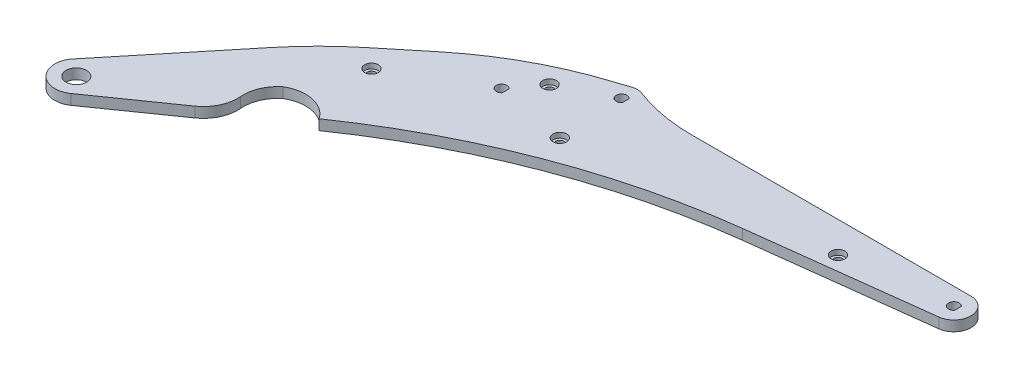
from build123d import *

# Parameters (mm, degrees)
SKETCH_3_R          = 3
EXTRUDE_1_DEPTH     = 3
FILLET_1_R          = 200
FILLET_3_R          = 50
SKETCH_4_R          = 1.25
CUT_EXTRUDE_1_DEPTH = 133.803621182
SKETCH_4_3_R        = 2
SKETCH_4_3_R_2      = 1.25
CUT_EXTRUDE_2_DEPTH = 1.5
FILLET_4_R          = 10
FILLET_5_R          = 10
FILLET_6_R          = 100


# Some blends are built 0.0001 mm under size
with BuildPart() as part:
    # 草图3 → 凸台-拉伸1 (new body)
    with BuildSketch(Plane(origin=(0, 0, 0), x_dir=(1, 0, 0), z_dir=(0, 1, 0))):
        with BuildLine():
            ThreePointArc((3.438749824, 0), (-1, 3.55), (-5.438749824, 0))
            Line((-5.438749824, 0), (-20, 0))
            Line((-20, 0), (-58.823128982, -31.75206117))
            Line((-58.823128982, -31.75206117), (-90.575190152, -70.575190152))
            ThreePointArc((-90.575190152, -70.575190152), (-90.944000004, -79.022324522), (-82.561153427, -80.12594721))
            Line((-82.561153427, -80.12594721), (-53.071679833, -59.477195502))
            Line((-53.071679833, -59.477195502), (-58.807444196, -51.285675059))
            Line((-58.807444196, -51.285675059), (-45.701011487, -42.108452077))
            Line((-45.701011487, -42.108452077), (-39.965247124, -50.29997252))
            Line((-39.965247124, -50.29997252), (0, -22.316005218))
            Line((0, -22.316005218), (100.609346717, -9.962730758))
            ThreePointArc((100.609346717, -9.962730758), (104.990673992, -4.694757302), (100, 0))
            Line((100, 0), (3.438749824, 0))
        make_face()
        with BuildLine():
            Line((0.2, -0.018929156), (0.2, -1.981070844))
            ThreePointArc((0.2, -1.981070844), (-2.55, -1), (0.2, -0.018929156))
        make_face(mode=Mode.SUBTRACT)
        with BuildLine():
            ThreePointArc((-19.8, -16.981070844), (-22.55, -16), (-19.8, -15.018929156))
            Line((-19.8, -15.018929156), (-19.8, -16.981070844))
        make_face(mode=Mode.SUBTRACT)
        with BuildLine():
            ThreePointArc((101.2, -5.981070844), (98.45, -5), (101.2, -4.018929156))
            Line((101.2, -4.018929156), (101.2, -5.981070844))
        make_face(mode=Mode.SUBTRACT)
        with Locations(Location((-86.150380304, -75, 0), (0, 0, 270))):
            Circle(SKETCH_3_R, mode=Mode.SUBTRACT)
    extrude(amount=EXTRUDE_1_DEPTH)

    # 圆角1
    # the kernel refuses this fillet: 200 mm, written as the material it adds along each edge
    with BuildSketch(Plane(origin=(0, 0, 22.316005218), x_dir=(-0.8191520442889868, 0, 0.5735764363510532), z_dir=(0, 1, 0))) as fillet_1_piece_1:
        with BuildLine():
            CenterArc((49.871110762, 199.997070178), FILLET_1_R, 242, 27.689869999)
            Line((-44.023201795, 23.407551606), (-45.901088046, 19.875761235))
            Line((-45.901088046, 19.875761235), (-1.877886251, -3.531790371))
            Line((-1.877886251, -3.531790371), (0, -4))
            ThreePointArc((0, -4), (24.394279061, -4), (48.76690707, -3.999941404))
            Line((48.76690707, -3.999941404), (48.788558122, 0))
        make_face()
    extrude(amount=3)

    # 圆角3
    # the kernel refuses this fillet: 50 mm, written as the material it adds along each edge
    with BuildSketch(Plane(origin=(3.438749824, 0, 0), x_dir=(-0.6554771924780477, 0, -0.7552149694895463), z_dir=(0, 1, 0))) as fillet_3_piece_1:
        with BuildLine():
            CenterArc((27.982022488, -44.040522037), FILLET_3_R, 118.259718548, 20.784438328)
            Line((-9.778725986, -11.266662413), (-10.533940956, -10.611185221))
            Line((-10.533940956, -10.611185221), (-0.755214969, 0.655477192))
            Line((-0.755214969, 0.655477192), (0.473469078, 0.880810441))
            ThreePointArc((0.473469078, 0.880810441), (2.154284303, 0.457687505), (3.835099529, 0.880810441))
            Line((3.835099529, 0.880810441), (4.308568607, 0))
        make_face()
    extrude(amount=3)
    with BuildSketch(Plane(origin=(-5.438749824, 0, 0), x_dir=(-1, 0, 0), z_dir=(0, 1, 0))) as fillet_3_piece_2:
        with BuildLine():
            CenterArc((14.921910743, -49.998699223), FILLET_3_R, 90.413290151, 20.374998027)
            Line((-2.823882627, -3.253787011), (-3.178798495, -2.318888767))
            ThreePointArc((-3.178798495, -2.318888767), (-1.757658507, -1.32685396), (-0.975549412, 0.21978022))
            Line((-0.975549412, 0.21978022), (0, 1))
            ThreePointArc((0, 1), (7.280625088, 1), (14.554036965, 0.999973984))
            Line((14.554036965, 0.999973984), (14.561250176, 0))
        make_face()
    extrude(amount=3)

    # 草图4 → 切除-拉伸1 (cut, through all)
    with BuildSketch(Plane(origin=(0, 3, 0), x_dir=(1, 0, 0), z_dir=(0, 1, 0))):
        with Locations(Location((70.2, -9, 0), (0, 0, 270))):
            Circle(SKETCH_4_R)
        with Locations(Location((0, -20, 0), (0, 0, 270))):
            Circle(SKETCH_4_R)
        with Locations(Location((-45, -30, 0), (0, 0, 270))):
            Circle(SKETCH_4_R)
        with Locations(Location((-15, -8, 0), (0, 0, 270))):
            Circle(SKETCH_4_R)
    extrude(amount=-CUT_EXTRUDE_1_DEPTH, mode=Mode.SUBTRACT)

    # 草图4<3> → 切除-拉伸2 (cut)
    # profile 1 of 4: a face of its own
    with BuildSketch(Plane(origin=(0, 3, 0), x_dir=(1, 0, 0), z_dir=(0, 1, 0))):
        with Locations(Location((70.2, -9, 0), (0, 0, 270))):
            Circle(SKETCH_4_3_R)
        with Locations(Location((70.2, -9, 0), (0, 0, 270))):
            Circle(SKETCH_4_3_R_2, mode=Mode.SUBTRACT)
    # profile 2 of 4: a face of its own
    with BuildSketch(Plane(origin=(0, 3, 0), x_dir=(1, 0, 0), z_dir=(0, 1, 0))):
        with Locations(Location((0, -20, 0), (0, 0, 270))):
            Circle(SKETCH_4_3_R)
        with Locations(Location((0, -20, 0), (0, 0, 270))):
            Circle(SKETCH_4_3_R_2, mode=Mode.SUBTRACT)
    # profile 3 of 4: a face of its own
    with BuildSketch(Plane(origin=(0, 3, 0), x_dir=(1, 0, 0), z_dir=(0, 1, 0))):
        with Locations(Location((-45, -30, 0), (0, 0, 270))):
            Circle(SKETCH_4_3_R)
        with Locations(Location((-45, -30, 0), (0, 0, 270))):
            Circle(SKETCH_4_3_R_2, mode=Mode.SUBTRACT)
    # profile 4 of 4: a face of its own
    with BuildSketch(Plane(origin=(0, 3, 0), x_dir=(1, 0, 0), z_dir=(0, 1, 0))):
        with Locations(Location((-15, -8, 0), (0, 0, 270))):
            Circle(SKETCH_4_3_R)
        with Locations(Location((-15, -8, 0), (0, 0, 270))):
            Circle(SKETCH_4_3_R_2, mode=Mode.SUBTRACT)
    extrude(amount=-CUT_EXTRUDE_2_DEPTH, mode=Mode.SUBTRACT)

    # 圆角4
    fillet_4_edges = [part.edges().sort_by_distance(p)[0] for p in [
        (-53.071679833, 1.5, 59.477195502),
    ]]
    fillet(fillet_4_edges, radius=FILLET_4_R - 0.0001)  # a hair under: the kernel refuses the full size

    # 圆角5
    # the kernel refuses this fillet: 10 mm, written as the material it adds along each edge
    with BuildSketch(Plane(origin=(-45.701011487, 0, 42.108452077), x_dir=(-0.8191520442889864, 0, 0.5735764363510539), z_dir=(0, 1, 0))) as fillet_5_piece_1:
        with BuildLine():
            CenterArc((FILLET_5_R, FILLET_5_R), FILLET_5_R, 180, 90)
            Line((0, FILLET_5_R), (0, 0))
            Line((0, 0), (FILLET_5_R, 0))
        make_face()
    extrude(amount=3)
    with BuildSketch(Plane(origin=(-58.807444196, 0, 51.285675059), x_dir=(0.3420261980761126, 0, 0.9396904170148804), z_dir=(0, 1, 0))) as fillet_5_piece_2:
        with BuildLine():
            CenterArc((7.764622652, 9.659249058), FILLET_5_R, 194.999630824, 60.000165399)
            Line((-1.894652287, 7.071120845), (-2.860579781, 6.812308023))
            Line((-2.860579781, 6.812308023), (-0.965927494, -0.258812821))
            Line((-0.965927494, -0.258812821), (0.258812821, -0.965927494))
            ThreePointArc((0.258812821, -0.965927494), (0.258909414, -0.965901613), (4.917575367, -0.965924906))
            Line((4.917575367, -0.965924906), (5.176397847, 0))
        make_face()
    extrude(amount=3)

    # 圆角6
    fillet_6_edges = [part.edges().sort_by_distance(p)[0] for p in [
        (-58.823128982, 1.5, 31.75206117),
        (-20, 1.5, 0),
    ]]
    fillet(fillet_6_edges, radius=FILLET_6_R)


solid = part.part
